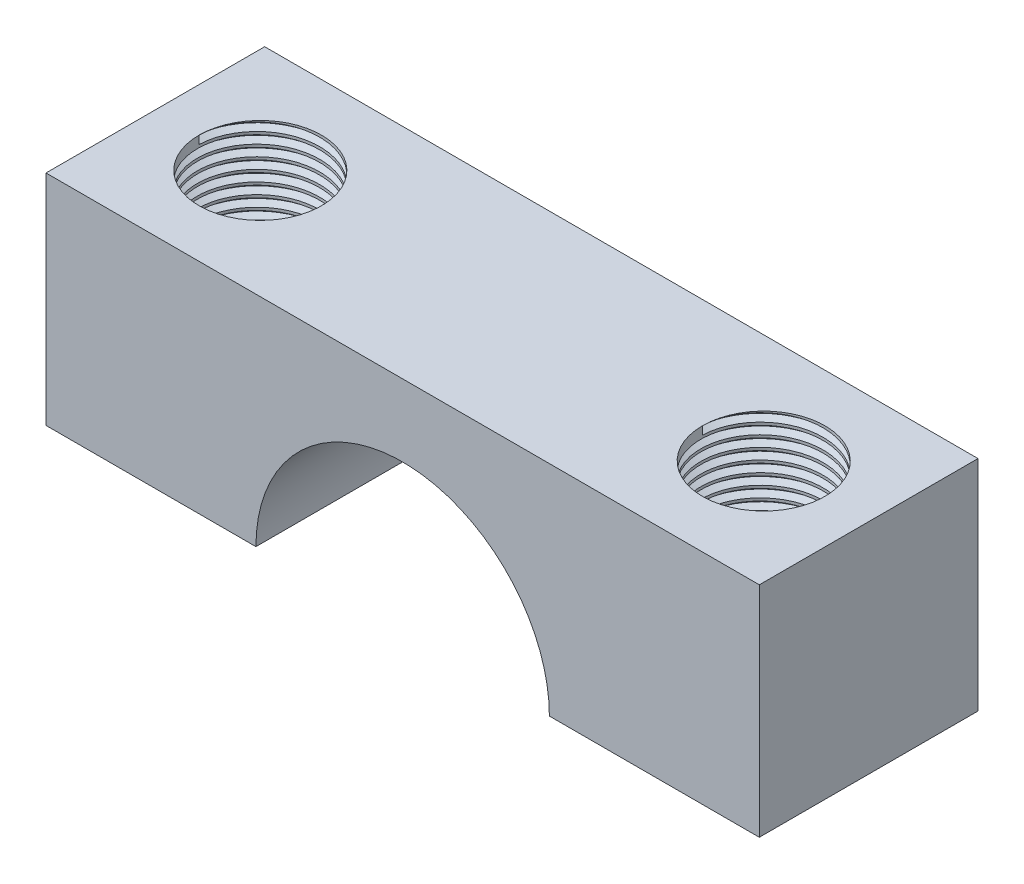
from build123d import *

# Parameters (mm, degrees)
SKETCH1_W                = 16.31
SKETCH1_H                = 5
BOSS_EXTRUDE3_DEPTH      = 5
CUT_EXTRUDE9_DEPTH       = 5
CUT_EXTRUDE10_DEPTH      = 2.5
CUT_EXTRUDE10_DEPTH_BACK = 2.5
SKETCH4_R                = 1.4
THREAD1_PITCH            = 0.25
THREAD2_PITCH            = 0.25


with BuildPart() as part:
    # Sketch1 → Boss-Extrude3 (new body)
    with BuildSketch(Plane.XY):
        Rectangle(SKETCH1_W, SKETCH1_H)
    extrude(amount=-BOSS_EXTRUDE3_DEPTH)

    # Sketch3 → Cut-Extrude9 (cut)
    with BuildSketch(Plane.XY):
        with BuildLine():
            Line((-3.355, -2.5), (3.355, -2.5))
            ThreePointArc((3.355, -2.5), (0, 0.855), (-3.355, -2.5))
        make_face()
    extrude(amount=-CUT_EXTRUDE9_DEPTH, mode=Mode.SUBTRACT)

    # Sketch4 → Cut-Extrude10 (cut, two sides: drawn at the far end of the back side and taken through both)
    with BuildSketch(Plane(origin=(0, 0, 0), x_dir=(1, 0, 0), z_dir=(0, 1, 0)).offset(-CUT_EXTRUDE10_DEPTH_BACK)):
        with Locations(Location((-5.755, 2.5, 0), (0, 0, 270))):
            Circle(SKETCH4_R)
        with Locations(Location((5.755, 2.5, 0), (0, 0, 270))):
            Circle(SKETCH4_R)
    extrude(amount=CUT_EXTRUDE10_DEPTH + CUT_EXTRUDE10_DEPTH_BACK, mode=Mode.SUBTRACT)

    # Thread1: the profile of Thread Profile1 profile screwed along a right-hand helix of 20 turns, 6 arcs to a turn; built about Z, then put on its axis
    thread1_z = Axis((0, 0, 0), (0, 0, 1))
    thread1_corners = [(1.3997, 0, -0.000173205), (1.535316469, 0, 0.078125), (1.535316469, 0, 0.109375), (1.3997, 0, 0.187673204)]
    with BuildLine(mode=Mode.PRIVATE) as thread1_profile:
        Line(thread1_corners[0], thread1_corners[1])
        Line(thread1_corners[1], thread1_corners[2])
        Line(thread1_corners[2], thread1_corners[3])
        Line(thread1_corners[3], thread1_corners[0])
    thread1_cap = Face(thread1_profile.wire())
    thread1_turn_angles = [0, 30, 60, 90, 120, 150, 180, 210, 240, 270, 300, 330, 360]
    thread1_turn_weights = [1, 0.8660254037844387, 1, 0.8660254037844387, 1, 0.8660254037844387, 1, 0.8660254037844387, 1, 0.8660254037844387, 1, 0.8660254037844387, 1]
    thread1_turn_rails = [Edge.make_bspline([Vector(p[0], p[1], 0).rotate(thread1_z, thread1_turn_angles[k]) / thread1_turn_weights[k] + Vector(0, 0, p[2] + THREAD1_PITCH * thread1_turn_angles[k] / 360) for k in range(13)], [0, 0, 0, 1, 1, 2, 2, 3, 3, 4, 4, 5, 5, 6, 6, 6], 2, thread1_turn_weights) for p in thread1_corners]
    thread1_turn_sides = [Face.make_surface_from_curves(thread1_turn_rails[p[0]], thread1_turn_rails[p[1]]) for p in [(0, 1), (1, 2), (2, 3), (3, 0)]]
    thread1 = Plane(origin=(-5.755, 2.5, -2.5), x_dir=(-1, 0, 0), z_dir=(0, -1, 0)) * Solid(Shell([*[p.moved(Location((0, 0, THREAD1_PITCH * i))) for i in range(20) for p in thread1_turn_sides], thread1_cap, thread1_cap.rotate(thread1_z, 7200).moved(Location((0, 0, THREAD1_PITCH * 7200 / 360)))]))
    add(thread1, mode=Mode.SUBTRACT)

    # Thread2: the profile of Thread Profile2 profile screwed along a right-hand helix of 20 turns, 6 arcs to a turn; built about Z, then put on its axis
    thread2_z = Axis((0, 0, 0), (0, 0, 1))
    thread2_corners = [(1.3997, 0, -0.000173205), (1.535316469, 0, 0.078125), (1.535316469, 0, 0.109375), (1.3997, 0, 0.187673204)]
    with BuildLine(mode=Mode.PRIVATE) as thread2_profile:
        Line(thread2_corners[0], thread2_corners[1])
        Line(thread2_corners[1], thread2_corners[2])
        Line(thread2_corners[2], thread2_corners[3])
        Line(thread2_corners[3], thread2_corners[0])
    thread2_cap = Face(thread2_profile.wire())
    thread2_turn_angles = [0, 30, 60, 90, 120, 150, 180, 210, 240, 270, 300, 330, 360]
    thread2_turn_weights = [1, 0.8660254037844387, 1, 0.8660254037844387, 1, 0.8660254037844387, 1, 0.8660254037844387, 1, 0.8660254037844387, 1, 0.8660254037844387, 1]
    thread2_turn_rails = [Edge.make_bspline([Vector(p[0], p[1], 0).rotate(thread2_z, thread2_turn_angles[k]) / thread2_turn_weights[k] + Vector(0, 0, p[2] + THREAD2_PITCH * thread2_turn_angles[k] / 360) for k in range(13)], [0, 0, 0, 1, 1, 2, 2, 3, 3, 4, 4, 5, 5, 6, 6, 6], 2, thread2_turn_weights) for p in thread2_corners]
    thread2_turn_sides = [Face.make_surface_from_curves(thread2_turn_rails[p[0]], thread2_turn_rails[p[1]]) for p in [(0, 1), (1, 2), (2, 3), (3, 0)]]
    thread2 = Plane(origin=(5.755, 2.5, -2.5), x_dir=(-1, 0, 0), z_dir=(0, -1, 0)) * Solid(Shell([*[p.moved(Location((0, 0, THREAD2_PITCH * i))) for i in range(20) for p in thread2_turn_sides], thread2_cap, thread2_cap.rotate(thread2_z, 7200).moved(Location((0, 0, THREAD2_PITCH * 7200 / 360)))]))
    add(thread2, mode=Mode.SUBTRACT)


solid = part.part
